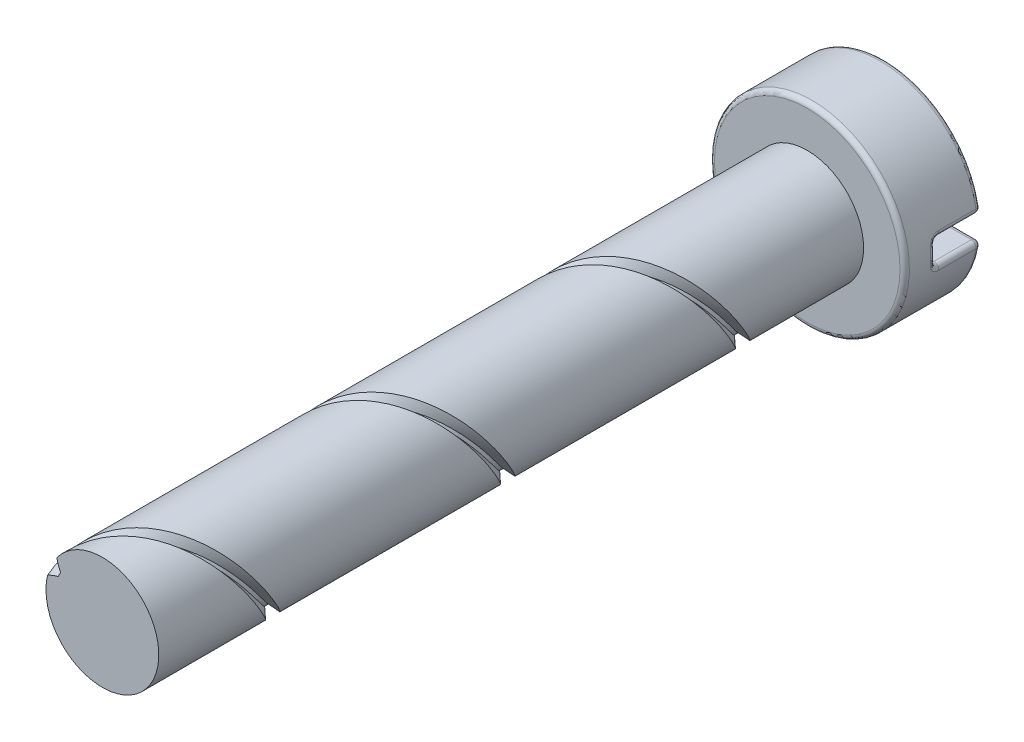
from build123d import *

# Parameters (mm, degrees)
SKETCH1_R           = 2.4
BOSS_EXTRUDE1_DEPTH = 30
SKETCH2_R           = 4.15
BOSS_EXTRUDE2_DEPTH = 3.3
THREAD1_PITCH       = 10
SKETCH4_W           = 10
SKETCH4_H           = 1
CUT_EXTRUDE1_DEPTH  = 2
FILLET1_R           = 0.2


with BuildPart() as part:
    # Sketch1 → Boss-Extrude1 (new body)
    with BuildSketch(Plane.XY):
        Circle(SKETCH1_R)
    extrude(amount=BOSS_EXTRUDE1_DEPTH)

    # Sketch2 → Boss-Extrude2 (add)
    with BuildSketch(Plane(origin=(0, 0, 0), x_dir=(-1, 0, 0), z_dir=(0, 0, -1))):
        Circle(SKETCH2_R)
    extrude(amount=BOSS_EXTRUDE2_DEPTH)

    # Thread1: arcs per turn and ends read off the stored shape
    # Thread1: the profile of Thread Profile1 profile screwed along a right-hand helix through 3 turns, 16 arcs to a turn; built about Z, then put on its axis
    thread1_z = Axis((0, 0, 0), (0, 0, 1))
    thread1_corners = [(2.4003, 0, -0.000173205), (2.4003, 0, 0.612673203), (2.021113887, 0, 0.393749999), (2.021113887, 0, 0.218749999)]
    with BuildLine(mode=Mode.PRIVATE) as thread1_profile:
        Line(thread1_corners[0], thread1_corners[1])
        Line(thread1_corners[1], thread1_corners[2])
        Line(thread1_corners[2], thread1_corners[3])
        Line(thread1_corners[3], thread1_corners[0])
    thread1_cap = Face(thread1_profile.wire())
    thread1_turn_angles = [0, 11.25, 22.5, 33.75, 45, 56.25, 67.5, 78.75, 90, 101.25, 112.5, 123.75, 135, 146.25, 157.5, 168.75, 180, 191.25, 202.5, 213.75, 225, 236.25, 247.5, 258.75, 270, 281.25, 292.5, 303.75, 315, 326.25, 337.5, 348.75, 360]
    thread1_turn_weights = [1, 0.9807852804032304, 1, 0.9807852804032304, 1, 0.9807852804032304, 1, 0.9807852804032304, 1, 0.9807852804032304, 1, 0.9807852804032304, 1, 0.9807852804032304, 1, 0.9807852804032304, 1, 0.9807852804032304, 1, 0.9807852804032304, 1, 0.9807852804032304, 1, 0.9807852804032304, 1, 0.9807852804032304, 1, 0.9807852804032304, 1, 0.9807852804032304, 1, 0.9807852804032304, 1]
    thread1_turn_rails = [Edge.make_bspline([Vector(p[0], p[1], 0).rotate(thread1_z, thread1_turn_angles[k]) / thread1_turn_weights[k] + Vector(0, 0, p[2] + THREAD1_PITCH * thread1_turn_angles[k] / 360) for k in range(33)], [0, 0, 0, 1, 1, 2, 2, 3, 3, 4, 4, 5, 5, 6, 6, 7, 7, 8, 8, 9, 9, 10, 10, 11, 11, 12, 12, 13, 13, 14, 14, 15, 15, 16, 16, 16], 2, thread1_turn_weights) for p in thread1_corners]
    thread1_turn_sides = [Face.make_surface_from_curves(thread1_turn_rails[p[0]], thread1_turn_rails[p[1]]) for p in [(0, 1), (1, 2), (2, 3), (3, 0)]]
    thread1 = Plane(origin=(0, 0, 31), x_dir=(-1, 0, 0), z_dir=(0, 0, -1)) * Solid(Shell([*[p.moved(Location((0, 0, THREAD1_PITCH * i))) for i in range(3) for p in thread1_turn_sides], thread1_cap, thread1_cap.rotate(thread1_z, 1080).moved(Location((0, 0, THREAD1_PITCH * 1080 / 360)))]))
    add(thread1, mode=Mode.SUBTRACT)

    # Sketch4 → Cut-Extrude1 (cut)
    with BuildSketch(Plane(origin=(0, 0, -3.3), x_dir=(-1, 0, 0), z_dir=(0, 0, -1))):
        Rectangle(SKETCH4_W, SKETCH4_H)
    extrude(amount=-CUT_EXTRUDE1_DEPTH, mode=Mode.SUBTRACT)

    # Fillet1
    fillet1_edges = [part.edges().sort_by_distance(p)[0] for p in [
        (0, -4.15, -3.3),
        (0, -0.5, -3.3),
        (0, 0.5, -3.3),
        (4.15, 0, -1.3),
        (-4.142435459, 0.250456527, -1.3),
        (-4.119769411, 0.5, -2.3),
        (0, 0.5, -1.3),
        (4.119769411, 0.5, -2.3),
        (4.119769411, -0.5, -2.3),
        (0, -0.5, -1.3),
        (-4.119769411, -0.5, -2.3),
        (4.15, 0, 0),
        (0, 4.15, -3.3),
    ]]
    fillet(fillet1_edges, radius=FILLET1_R)


solid = part.part
